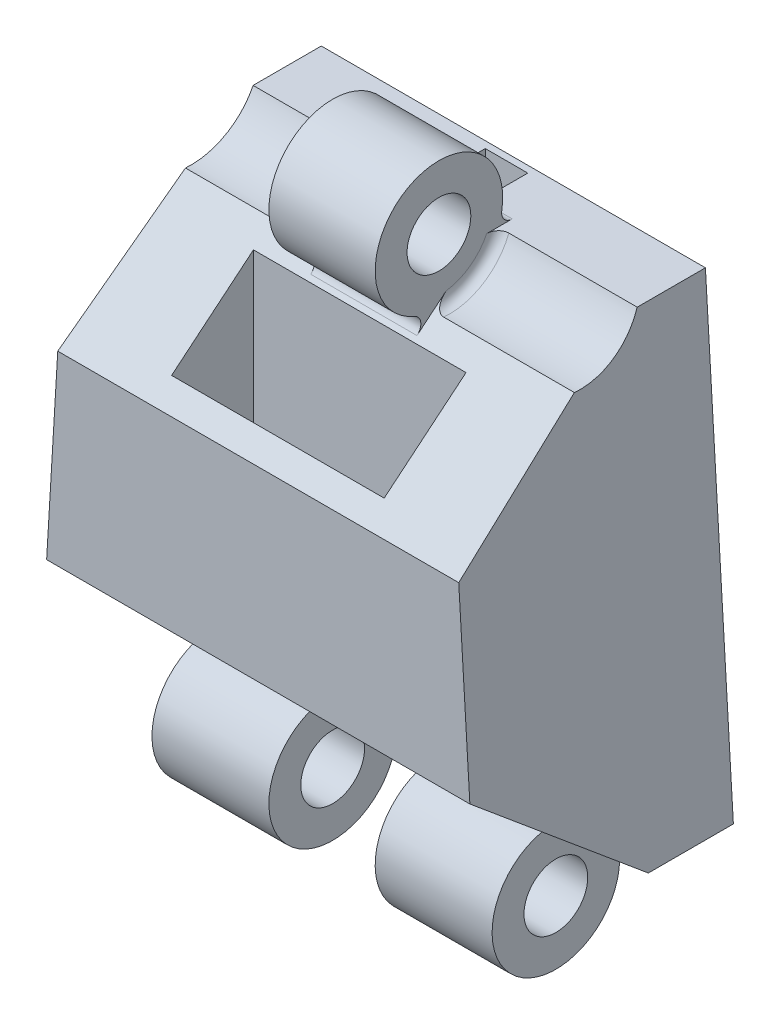
from build123d import *

# Parameters (mm, degrees)
BOSS_EXTRUDE1_DEPTH            = 12
CUT_EXTRUDE1_DEPTH             = 28.113370808
CUT_EXTRUDE1_DEPTH_BACK        = 28.113370808
SKETCH6_R                      = 3
SKETCH6_R_2                    = 1.5
BOSS_EXTRUDE2_DEPTH            = 8
SKETCH6_3_R                    = 3
SKETCH6_3_R_2                  = 1.5
CUT_EXTRUDE2_DEPTH             = 2.5
CUT_EXTRUDE3_DEPTH             = 28.113370808
CUT_EXTRUDE3_DEPTH_BACK        = 28.113370808
SKETCH9_R                      = 3
SKETCH9_R_2                    = 1.5
BOSS_EXTRUDE3_DEPTH            = 2.5
CUT_EXTRUDE4_START             = 10
SKETCH11_R                     = 3
CUT_EXTRUDE4_DEPTH             = 10
SKETCH12_R                     = 3
CUT_EXTRUDE5_DEPTH             = 10
FILLET1_R                      = 0.5
FILLET2_R                      = 0.5
CUT_EXTRUDE6_REACH             = 62.032
SKETCH14_W                     = 10
SKETCH14_H                     = 3.849855631
CUT_EXTRUDE6_DIRECTION_2_REACH = 62.032
SKETCH15_W                     = 2
SKETCH15_H                     = 26.365035569
CUT_EXTRUDE7_DEPTH             = 1


with BuildPart() as part:
    # Sketch1 → Boss-Extrude1 (new body)
    with BuildSketch(Plane.XY):
        Polygon((-56.5742778, 0), (-35.873082033, 0), (-37.188679916, 22), (-55.258679916, 22), align=None)
    extrude(amount=BOSS_EXTRUDE1_DEPTH)

    # Sketch3 → Cut-Extrude1 (cut, two sides: drawn at the far end of the back side and taken through both)
    with BuildSketch(Plane(origin=(-46.223679916, 0, 0), x_dir=(0, 0, -1), z_dir=(1, 0, 0)).offset(-CUT_EXTRUDE1_DEPTH_BACK)):
        Polygon((-12, 0), (-4, 0), (-12, 6.613954944), align=None)
    extrude(amount=CUT_EXTRUDE1_DEPTH + CUT_EXTRUDE1_DEPTH_BACK, mode=Mode.SUBTRACT)

    # Sketch6 → Boss-Extrude2 (add, symmetric)
    with BuildSketch(Plane(origin=(-46.223679916, 0, 0), x_dir=(0, 0, -1), z_dir=(1, 0, 0))):
        with Locations((-6, -1.1)):
            Circle(SKETCH6_R)
        with Locations((-6, -1.1)):
            Circle(SKETCH6_R_2, mode=Mode.SUBTRACT)
    extrude(amount=BOSS_EXTRUDE2_DEPTH, both=True)

    # Sketch6<3> → Cut-Extrude2 (cut, symmetric)
    with BuildSketch(Plane(origin=(-46.223679916, 0, 0), x_dir=(0, 0, -1), z_dir=(1, 0, 0))):
        with Locations((-6, -1.1)):
            Circle(SKETCH6_3_R)
        with Locations((-6, -1.1)):
            Circle(SKETCH6_3_R_2, mode=Mode.SUBTRACT)
    extrude(amount=CUT_EXTRUDE2_DEPTH, both=True, mode=Mode.SUBTRACT)

    # Sketch8 → Cut-Extrude3 (cut, two sides: drawn at the far end of the back side and taken through both)
    with BuildSketch(Plane(origin=(-46.223679916, 0, 0), x_dir=(0, 0, -1), z_dir=(1, 0, 0)).offset(-CUT_EXTRUDE3_DEPTH_BACK)):
        Polygon((-12, 15.370362001), (-4, 22), (-12, 22), align=None)
    extrude(amount=CUT_EXTRUDE3_DEPTH + CUT_EXTRUDE3_DEPTH_BACK, mode=Mode.SUBTRACT)

    # Sketch9 → Boss-Extrude3 (add, symmetric)
    with BuildSketch(Plane(origin=(-46.223679916, 0, 0), x_dir=(0, 0, -1), z_dir=(1, 0, 0))):
        with Locations((-6, 23.1)):
            Circle(SKETCH9_R)
        with Locations((-6, 23.1)):
            Circle(SKETCH9_R_2, mode=Mode.SUBTRACT)
    extrude(amount=BOSS_EXTRUDE3_DEPTH, both=True)

    # Sketch11 → Cut-Extrude4 (cut)
    with BuildSketch(Plane(origin=(-43.723679916, 0, 0), x_dir=(0, 0, -1), z_dir=(1, 0, 0)).offset(CUT_EXTRUDE4_START)):
        with Locations((-6, 23.1)):
            Circle(SKETCH11_R)
    extrude(amount=-CUT_EXTRUDE4_DEPTH, mode=Mode.SUBTRACT)

    # Sketch12 → Cut-Extrude5 (cut)
    with BuildSketch(Plane.ZY.offset(48.723679916)):
        with Locations((6, 23.1)):
            Circle(SKETCH12_R)
    extrude(amount=CUT_EXTRUDE5_DEPTH, mode=Mode.SUBTRACT)

    # Fillet1
    fillet1_edges = [part.edges().sort_by_distance(p)[0] for p in [
        (-46.223679916, 22, 3.208942853),
        (-46.223679916, 20.112838065, 6.277242812),
    ]]
    fillet(fillet1_edges, radius=FILLET1_R)

    # Fillet2
    fillet2_edges = [part.edges().sort_by_distance(p)[0] for p in [
        (-48.723679916, 20.54464497, 4.42832552),
        (-43.723679916, 20.54464497, 4.42832552),
    ]]
    fillet(fillet2_edges, radius=FILLET2_R)

    # Cut-Extrude6: up to this plane
    cut_extrude6_end = Plane(origin=(-56.5742778, -1.96433929, 1.624006445), z_dir=(0, 0.7707129094412332, -0.6371825572162422))
    # Sketch14 → Cut-Extrude6 (cut, up to the surface)
    with BuildSketch(Plane(origin=(0, 10, 0), x_dir=(1, 0, 0), z_dir=(0, 1, 0)), mode=Mode.PRIVATE) as cut_extrude6_sk1:
        with Locations((-46.223679916, -9.151106834)):
            Rectangle(SKETCH14_W, SKETCH14_H)
    cut_extrude6_tool1 = split(extrude(cut_extrude6_sk1.sketch, amount=-CUT_EXTRUDE6_REACH, mode=Mode.PRIVATE), bisect_by=cut_extrude6_end, keep=Keep.BOTH, mode=Mode.PRIVATE)
    add(cut_extrude6_tool1.solids().sort_by_distance((-46.22368, 10, 9.151107))[0], mode=Mode.SUBTRACT)

    # Cut-Extrude6 direction 2: up to this plane
    cut_extrude6_direction_2_end = Plane(origin=(-56.5742778, 15.008030561, 12.437226213), z_dir=(0, 0.769971126082772, 0.6380787294674757))
    # Sketch14 → Cut-Extrude6 direction 2 (cut, up to the surface)
    with BuildSketch(Plane(origin=(0, 10, 0), x_dir=(1, 0, 0), z_dir=(0, 1, 0)), mode=Mode.PRIVATE) as cut_extrude6_direction_2_sk1:
        with Locations((-46.223679916, -9.151106834)):
            Rectangle(SKETCH14_W, SKETCH14_H)
    cut_extrude6_direction_2_tool1 = split(extrude(cut_extrude6_direction_2_sk1.sketch, amount=CUT_EXTRUDE6_DIRECTION_2_REACH, mode=Mode.PRIVATE), bisect_by=cut_extrude6_direction_2_end, keep=Keep.BOTH, mode=Mode.PRIVATE)
    add(cut_extrude6_direction_2_tool1.solids().sort_by_distance((-46.22368, 10, 9.151107))[0], mode=Mode.SUBTRACT)

    # Sketch15 → Cut-Extrude7 (cut, symmetric)
    with BuildSketch(Plane(origin=(-46.223679916, 0, 0), x_dir=(0, 0, -1), z_dir=(1, 0, 0))):
        with Locations((-1.32, 8.817482216)):
            Rectangle(SKETCH15_W, SKETCH15_H)
    extrude(amount=CUT_EXTRUDE7_DEPTH, both=True, mode=Mode.SUBTRACT)


solid = part.part
